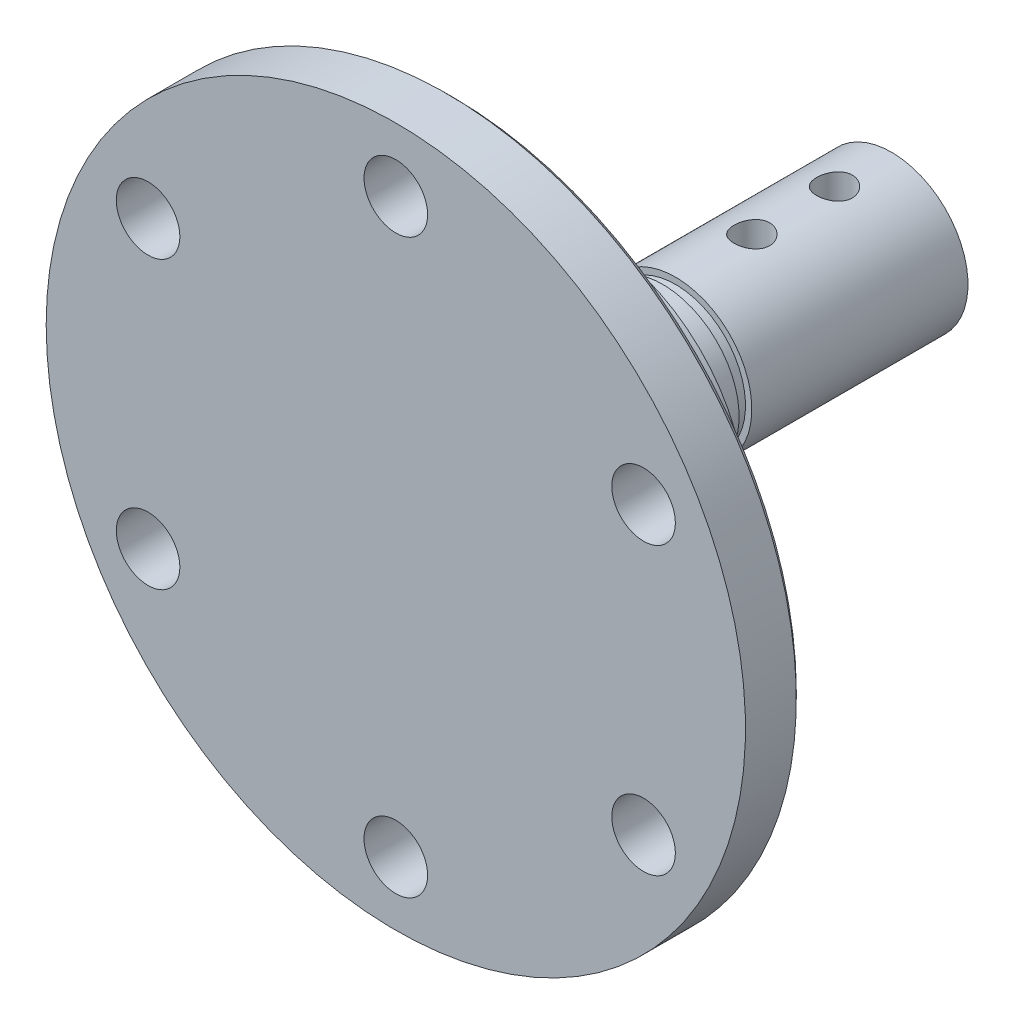
from build123d import *

# Parameters (mm, degrees)
SKETCH_2_R               = 6.5
CUT_EXTRUDE_1_DEPTH      = 28
CHAMFER_1_SIZE           = 0.5
SKETCH_3_R               = 2.5
CUT_EXTRUDE_2_DEPTH      = 23
SKETCH_4_R               = 3.1
CUT_EXTRUDE_3_DEPTH      = 20
SKETCH_5_R               = 16.017465931
CUT_EXTRUDE_4_DEPTH      = 30.8
SKETCH_6_R               = 12
SKETCH_6_R_2             = 9
EXTRUDE_1_DEPTH          = 13
SKETCH_7_R               = 12
SKETCH_7_R_2             = 9
CUT_EXTRUDE_5_DEPTH      = 0.5
CHAMFER_2_SIZE           = 0.5
CUT_EXTRUDE_6_DEPTH      = 20.5
CUT_EXTRUDE_6_DEPTH_BACK = 30.5
SKETCH_8_R               = 1.4


with BuildPart() as part:
    # 草图1 → 旋转1 (revolve)
    with BuildSketch(Plane(origin=(0, 0, 0), x_dir=(1, 0, 0), z_dir=(0, 1, 0))):
        Polygon((-6, 20.000076755), (-6, 36.000076755), (0, 36.000076755), (0, 30.000076755), (0, -33.8), (-9.249924022, -33.8), (-9.75, -33.299919915), (-9.75, -3), (-27.5, -3), (-27.5, 1.000001333), (-27.000001277, 1.5), (-9, 1.5), (-9, 6.5), (-9, 13.000076755), (-6, 13.000076755), (-6, 18.000076755), (-5.5, 18.000076755), (-5.5, 19.000076755), (-6, 19.000076755), align=None)
    revolve(axis=Axis((0, 0, -30.000076755), (0, 0, 1)))

    # 草图2 → 切除-拉伸1 (cut)
    with BuildSketch(Plane.XY.offset(33.8)):
        Circle(SKETCH_2_R)
    extrude(amount=-CUT_EXTRUDE_1_DEPTH, mode=Mode.SUBTRACT)

    # 倒角1
    chamfer_1_edges = [part.edges().sort_by_distance(p)[0] for p in [
        (-6.5, 0, 33.8),
    ]]
    chamfer(chamfer_1_edges, length=CHAMFER_1_SIZE)

    # 草图3 → 切除-拉伸2 (cut)
    with BuildSketch(Plane(origin=(0, 0, -1.5), x_dir=(-1, 0, 0), z_dir=(0, 0, -1))):
        with Locations((0, 22.5)):
            Circle(SKETCH_3_R)
        with Locations((19.485571585, 11.25)):
            Circle(SKETCH_3_R)
        with Locations((19.485571585, -11.25)):
            Circle(SKETCH_3_R)
        with Locations((0, -22.5)):
            Circle(SKETCH_3_R)
        with Locations((-19.485571585, -11.25)):
            Circle(SKETCH_3_R)
        with Locations((-19.485571585, 11.25)):
            Circle(SKETCH_3_R)
    extrude(amount=-CUT_EXTRUDE_2_DEPTH, mode=Mode.SUBTRACT)

    # 草图4 → 切除-拉伸3 (cut)
    with BuildSketch(Plane(origin=(0, 0, -36.000076755), x_dir=(-1, 0, 0), z_dir=(0, 0, -1))):
        Circle(SKETCH_4_R)
    extrude(amount=-CUT_EXTRUDE_3_DEPTH, mode=Mode.SUBTRACT)

    # 草图5 → 切除-拉伸4 (cut)
    with BuildSketch(Plane.XY.offset(33.8)):
        Circle(SKETCH_5_R)
    extrude(amount=-CUT_EXTRUDE_4_DEPTH, mode=Mode.SUBTRACT)

    # 草图6 → 凸台-拉伸1 (add)
    with BuildSketch(Plane(origin=(0, 0, -13.000076755), x_dir=(-1, 0, 0), z_dir=(0, 0, -1))):
        Circle(SKETCH_6_R)
        Circle(SKETCH_6_R_2, mode=Mode.SUBTRACT)
    extrude(amount=-EXTRUDE_1_DEPTH)

    # 草图7 → 切除-拉伸5 (cut)
    with BuildSketch(Plane(origin=(0, 0, -13.000076755), x_dir=(-1, 0, 0), z_dir=(0, 0, -1))):
        Circle(SKETCH_7_R)
        Circle(SKETCH_7_R_2, mode=Mode.SUBTRACT)
    extrude(amount=-CUT_EXTRUDE_5_DEPTH, mode=Mode.SUBTRACT)

    # 倒角2
    chamfer_2_edges = [part.edges().sort_by_distance(p)[0] for p in [
        (9, 0, -12.500076755),
    ]]
    chamfer(chamfer_2_edges, length=CHAMFER_2_SIZE - 0.0001)  # a hair under: the kernel refuses the full size

    # 草图8 → 切除-拉伸6 (cut, two sides: drawn at the far end of the back side and taken through both)
    with BuildSketch(Plane(origin=(0, 0, 0), x_dir=(1, 0, 0), z_dir=(0, 1, 0)).offset(-CUT_EXTRUDE_6_DEPTH_BACK)):
        with Locations(Location((0, 31.500076755, 0), (0, 0, 90))):
            Circle(SKETCH_8_R)
        with Locations(Location((0, 25.000076755, 0), (0, 0, 90))):
            Circle(SKETCH_8_R)
    extrude(amount=CUT_EXTRUDE_6_DEPTH + CUT_EXTRUDE_6_DEPTH_BACK, mode=Mode.SUBTRACT)


solid = part.part
